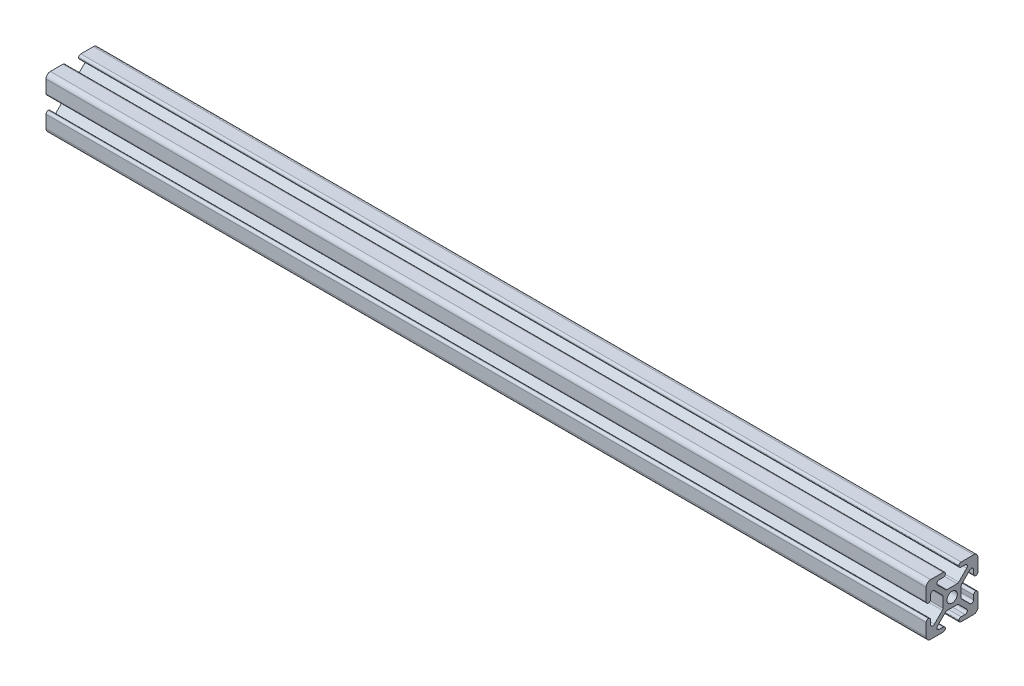
from build123d import *

# Parameters (mm, degrees)
SKETCH1_R           = 2.5
BOSS_EXTRUDE1_DEPTH = 425
FILLET1_R           = 1.065
FILLET2_R           = 2.13


with BuildPart() as part:
    # Sketch1 → Boss-Extrude1 (new body)
    with BuildSketch(Plane.YZ):
        Polygon((-12.5, -3.25), (-12.5, -12.5), (-3.25, -12.5), (-3.25, -10.37), (-8.863862556, -10.37), (-2.873862556, -4.38), (2.873862556, -4.38), (8.863862556, -10.37), (3.25, -10.37), (3.25, -12.5), (12.5, -12.5), (12.5, -3.25), (10.37, -3.25), (10.37, -8.863862556), (4.38, -2.873862556), (4.38, 2.873862556), (10.37, 8.863862556), (10.37, 3.25), (12.5, 3.25), (12.5, 12.5), (3.25, 12.5), (3.25, 10.37), (8.863862556, 10.37), (2.873862556, 4.38), (-2.873862556, 4.38), (-8.863862556, 10.37), (-3.25, 10.37), (-3.25, 12.5), (-12.5, 12.5), (-12.5, 3.25), (-10.37, 3.25), (-10.37, 8.863862556), (-4.38, 2.873862556), (-4.38, -2.873862556), (-10.37, -8.863862556), (-10.37, -3.25), align=None)
        with Locations(Location((0, 0, 0), (0, 0, 270))):
            Circle(SKETCH1_R, mode=Mode.SUBTRACT)
    extrude(amount=BOSS_EXTRUDE1_DEPTH)

    # Fillet1
    fillet1_edges = [part.edges().sort_by_distance(p)[0] for p in [
        (212.5, -10.37, -8.863862556),
        (212.5, 2.873862556, -4.38),
        (212.5, -2.873862556, -4.38),
        (212.5, -4.38, 2.873862556),
        (212.5, -4.38, -2.873862556),
        (212.5, -2.873862556, 4.38),
        (212.5, 2.873862556, 4.38),
        (212.5, 4.38, 2.873862556),
        (212.5, 4.38, -2.873862556),
        (212.5, -8.863862556, -10.37),
        (212.5, 8.863862556, -10.37),
        (212.5, 10.37, -8.863862556),
        (212.5, -10.37, 8.863862556),
        (212.5, -8.863862556, 10.37),
        (212.5, 10.37, 8.863862556),
        (212.5, 8.863862556, 10.37),
        (212.5, 12.5, 3.25),
        (212.5, -3.25, -12.5),
        (212.5, -10.37, 3.25),
        (212.5, 10.37, 3.25),
        (212.5, -10.37, -3.25),
        (212.5, -12.5, -3.25),
        (212.5, -12.5, 3.25),
        (212.5, 3.25, -10.37),
        (212.5, -3.25, -10.37),
        (212.5, 3.25, -12.5),
        (212.5, 10.37, -3.25),
        (212.5, 12.5, -3.25),
        (212.5, 3.25, 12.5),
        (212.5, 3.25, 10.37),
        (212.5, -3.25, 10.37),
        (212.5, -3.25, 12.5),
    ]]
    fillet(fillet1_edges, radius=FILLET1_R - 0.0001)  # a hair under: the kernel refuses the full size

    # Fillet2
    fillet2_edges = [part.edges().sort_by_distance(p)[0] for p in [
        (212.5, -12.5, 12.5),
        (212.5, 12.5, 12.5),
        (212.5, 12.5, -12.5),
        (212.5, -12.5, -12.5),
    ]]
    fillet(fillet2_edges, radius=FILLET2_R)


solid = part.part
